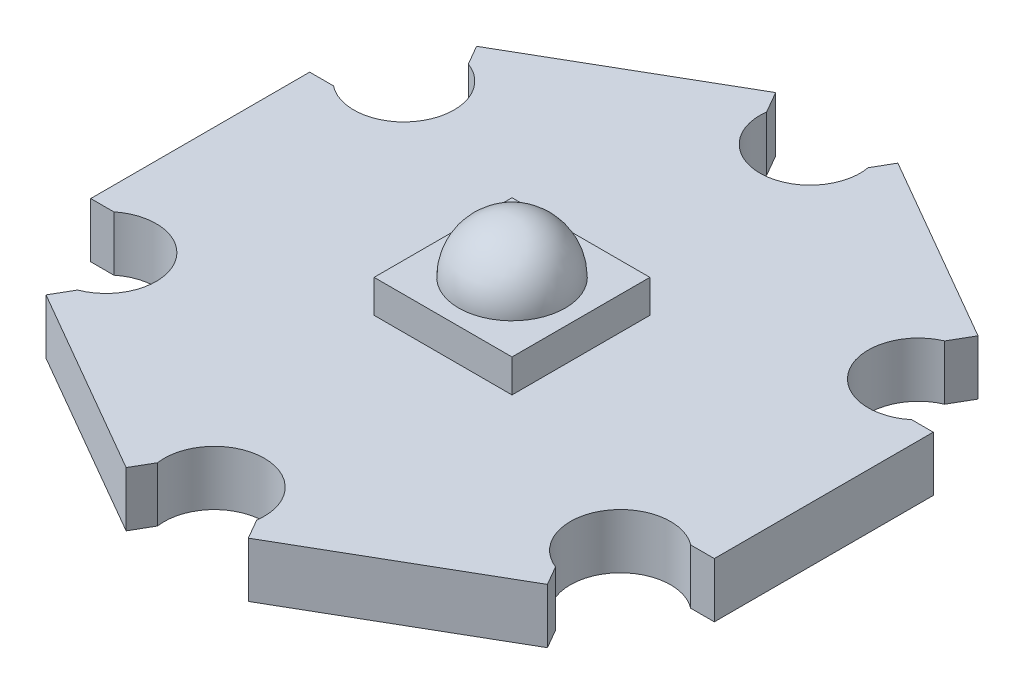
from build123d import *

# Parameters (mm, degrees)
SKETCH1_R           = 9.5
BOSS_EXTRUDE1_DEPTH = 1.75
BOSS_EXTRUDE4_START = -1.75
BOSS_EXTRUDE4_DEPTH = 1.75
SKETCH2_R           = 1.6
CUT_EXTRUDE1_DEPTH  = 1.75
SKETCH3_W           = 4.4
SKETCH3_H           = 4.4
BOSS_EXTRUDE2_DEPTH = 1.05
SKETCH4_R           = 1.7
BOSS_EXTRUDE3_DEPTH = 1.7
FILLET1_R           = 1.7


with BuildPart() as part:
    # Sketch1 → Boss-Extrude1 (new body)
    with BuildSketch(Plane(origin=(0, 0, 0), x_dir=(1, 0, 0), z_dir=(0, 1, 0))):
        with Locations(Location((0, 0, 0), (0, 0, 270))):
            Circle(SKETCH1_R)
    extrude(amount=BOSS_EXTRUDE1_DEPTH)

    # Sketch5 → Boss-Extrude4 (add)
    with BuildSketch(Plane(origin=(0, 1.75, 0), x_dir=(1, 0, 0), z_dir=(0, 1, 0)).offset(BOSS_EXTRUDE4_START)):
        with BuildLine():
            Line((-1.949608457, 10.363663389), (-8.000391543, 6.870242146))
            Line((-8.000391543, 6.870242146), (-7.44257413, 5.904074045))
            ThreePointArc((-7.44257413, 5.904074045), (-4.75, 8.227241336), (-1.391791044, 9.397495288))
            Line((-1.391791044, 9.397495288), (-1.949608457, 10.363663389))
        make_face()
        with BuildLine():
            ThreePointArc((-8.834365173, -3.493421243), (-9.5, 0), (-8.834365173, 3.493421243))
            Line((-8.834365173, 3.493421243), (-9.95, 3.493421243))
            Line((-9.95, 3.493421243), (-9.95, -3.493421243))
            Line((-9.95, -3.493421243), (-8.834365173, -3.493421243))
        make_face()
        with BuildLine():
            Line((1.949608457, 10.363663389), (1.391791044, 9.397495288))
            ThreePointArc((1.391791044, 9.397495288), (4.75, 8.227241336), (7.44257413, 5.904074045))
            Line((7.44257413, 5.904074045), (8.000391543, 6.870242146))
            Line((8.000391543, 6.870242146), (1.949608457, 10.363663389))
        make_face()
        with BuildLine():
            ThreePointArc((-1.391791044, -9.397495288), (-4.75, -8.227241336), (-7.44257413, -5.904074045))
            Line((-7.44257413, -5.904074045), (-8.000391543, -6.870242146))
            Line((-8.000391543, -6.870242146), (-1.949608457, -10.363663389))
            Line((-1.949608457, -10.363663389), (-1.391791044, -9.397495288))
        make_face()
        with BuildLine():
            Line((9.95, 3.493421243), (8.834365173, 3.493421243))
            ThreePointArc((8.834365173, 3.493421243), (9.5, 0), (8.834365173, -3.493421243))
            Line((8.834365173, -3.493421243), (9.95, -3.493421243))
            Line((9.95, -3.493421243), (9.95, 3.493421243))
        make_face()
        with BuildLine():
            ThreePointArc((7.44257413, -5.904074045), (4.75, -8.227241336), (1.391791044, -9.397495288))
            Line((1.391791044, -9.397495288), (1.949608457, -10.363663389))
            Line((1.949608457, -10.363663389), (8.000391543, -6.870242146))
            Line((8.000391543, -6.870242146), (7.44257413, -5.904074045))
        make_face()
    extrude(amount=BOSS_EXTRUDE4_DEPTH)

    # Sketch2 → Cut-Extrude1 (cut)
    with BuildSketch(Plane(origin=(0, 1.75, 0), x_dir=(1, 0, 0), z_dir=(0, 1, 0))):
        with Locations((0, -9.5)):
            Circle(SKETCH2_R)
        with Locations((-8.213474399, -4.742078212)):
            Circle(SKETCH2_R)
        with Locations((-8.199730461, 4.749960166)):
            Circle(SKETCH2_R)
        with Locations((0.027487877, 9.484076755)):
            Circle(SKETCH2_R)
        with Locations((8.240962276, 4.726154966)):
            Circle(SKETCH2_R)
        with Locations((8.227218338, -4.765883411)):
            Circle(SKETCH2_R)
    extrude(amount=-CUT_EXTRUDE1_DEPTH, mode=Mode.SUBTRACT)

    # Sketch3 → Boss-Extrude2 (add)
    with BuildSketch(Plane(origin=(0, 1.75, 0), x_dir=(1, 0, 0), z_dir=(0, 1, 0))):
        Rectangle(SKETCH3_W, SKETCH3_H)
    extrude(amount=BOSS_EXTRUDE2_DEPTH)

    # Sketch4 → Boss-Extrude3 (add)
    with BuildSketch(Plane(origin=(0, 2.8, 0), x_dir=(1, 0, 0), z_dir=(0, 1, 0))):
        with Locations(Location((0, 0, 0), (0, 0, 270))):
            Circle(SKETCH4_R)
    extrude(amount=BOSS_EXTRUDE3_DEPTH)

    # Fillet1
    fillet1_edges = [part.edges().sort_by_distance(p)[0] for p in [
        (0, 4.5, -1.7),
    ]]
    fillet(fillet1_edges, radius=FILLET1_R - 0.0001)  # a hair under: the kernel refuses the full size


solid = part.part
